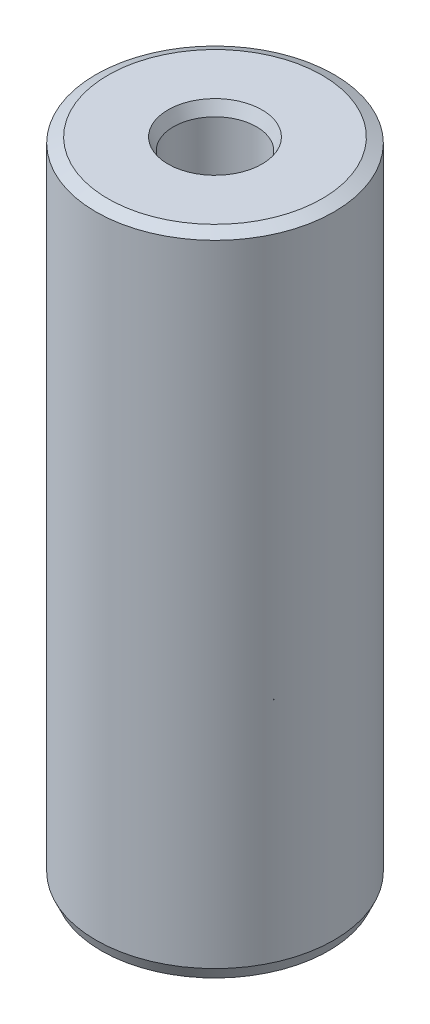
from build123d import *
from OCP.BRepFilletAPI import BRepFilletAPI_MakeChamfer

# Parameters (mm, degrees)
SKETCH1_R           = 5
BOSS_EXTRUDE1_DEPTH = 27.220511263
SKETCH2_R           = 1.747110378
CUT_EXTRUDE1_DEPTH  = 29.12394413
CHAMFER1_SIZE       = 0.227378218
CHAMFER1_SIZE2      = 0.503091618


with BuildPart() as part:
    # Sketch1 → Boss-Extrude1 (new body)
    with BuildSketch(Plane(origin=(0, 0, 0), x_dir=(1, 0, 0), z_dir=(0, 1, 0))):
        Circle(SKETCH1_R)
    extrude(amount=BOSS_EXTRUDE1_DEPTH)

    # Sketch2 → Cut-Extrude1 (cut, through all)
    with BuildSketch(Plane(origin=(0, 0, 0), x_dir=(1, 0, 0), z_dir=(0, 1, 0))):
        Circle(SKETCH2_R)
    extrude(amount=CUT_EXTRUDE1_DEPTH, mode=Mode.SUBTRACT)

    # Chamfer1: one chamfer whose edges measure the first distance from different faces: ONE call of the kernel's chamfer builder (chamfer() names one face for all edges)
    chamfer1_edges_1 = [part.edges().sort_by_distance(p)[0] for p in [
        (-1.747110378, 27.220511263, 0),
    ]]
    chamfer1_side_1 = [part.faces().sort_by_distance(p)[0] for p in [
        (-4.858578644, 27.220511263, 0),
    ]]
    chamfer1_edges_2 = [part.edges().sort_by_distance(p)[0] for p in [
        (-1.747110378, 0, 0),
    ]]
    chamfer1_side_2 = [part.faces().sort_by_distance(p)[0] for p in [
        (-1.747110378, 13.610255632, 0),
    ]]
    chamfer1_edges_3 = [part.edges().sort_by_distance(p)[0] for p in [
        (-5, 0, 0),
    ]]
    chamfer1_side_3 = [part.faces().sort_by_distance(p)[0] for p in [
        (-4.858578644, 0, 0),
    ]]
    chamfer1_edges_4 = [part.edges().sort_by_distance(p)[0] for p in [
        (-5, 27.220511263, 0),
    ]]
    chamfer1_side_4 = [part.faces().sort_by_distance(p)[0] for p in [
        (-5, 13.610255632, 0),
    ]]
    chamfer1 = BRepFilletAPI_MakeChamfer(part.part.solid().wrapped)
    for e in chamfer1_edges_1:
        chamfer1.Add(CHAMFER1_SIZE, CHAMFER1_SIZE2, e.wrapped, chamfer1_side_1[0].wrapped)  # the first distance lies on this face
    for e in chamfer1_edges_2:
        chamfer1.Add(CHAMFER1_SIZE, CHAMFER1_SIZE2, e.wrapped, chamfer1_side_2[0].wrapped)  # the first distance lies on this face
    for e in chamfer1_edges_3:
        chamfer1.Add(CHAMFER1_SIZE, CHAMFER1_SIZE2, e.wrapped, chamfer1_side_3[0].wrapped)  # the first distance lies on this face
    for e in chamfer1_edges_4:
        chamfer1.Add(CHAMFER1_SIZE, CHAMFER1_SIZE2, e.wrapped, chamfer1_side_4[0].wrapped)  # the first distance lies on this face
    add(Compound.cast(chamfer1.Shape()), mode=Mode.REPLACE)


solid = part.part
